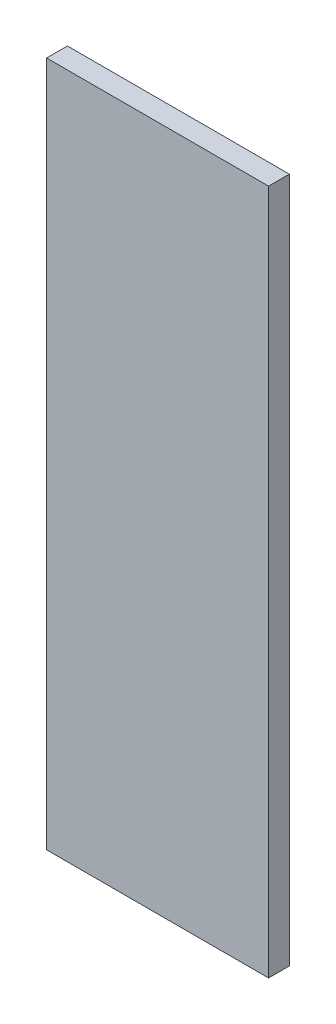
from build123d import *

# Parameters (mm, degrees)
SKETCH1_W           = 203.2
SKETCH1_H           = 627.888
BOSS_EXTRUDE1_DEPTH = 19.05


with BuildPart() as part:
    # Sketch1 → Boss-Extrude1 (new body)
    with BuildSketch(Plane.XY):
        with Locations((85.591334573, -284.713362757)):
            Rectangle(SKETCH1_W, SKETCH1_H)
    extrude(amount=BOSS_EXTRUDE1_DEPTH)


solid = part.part
